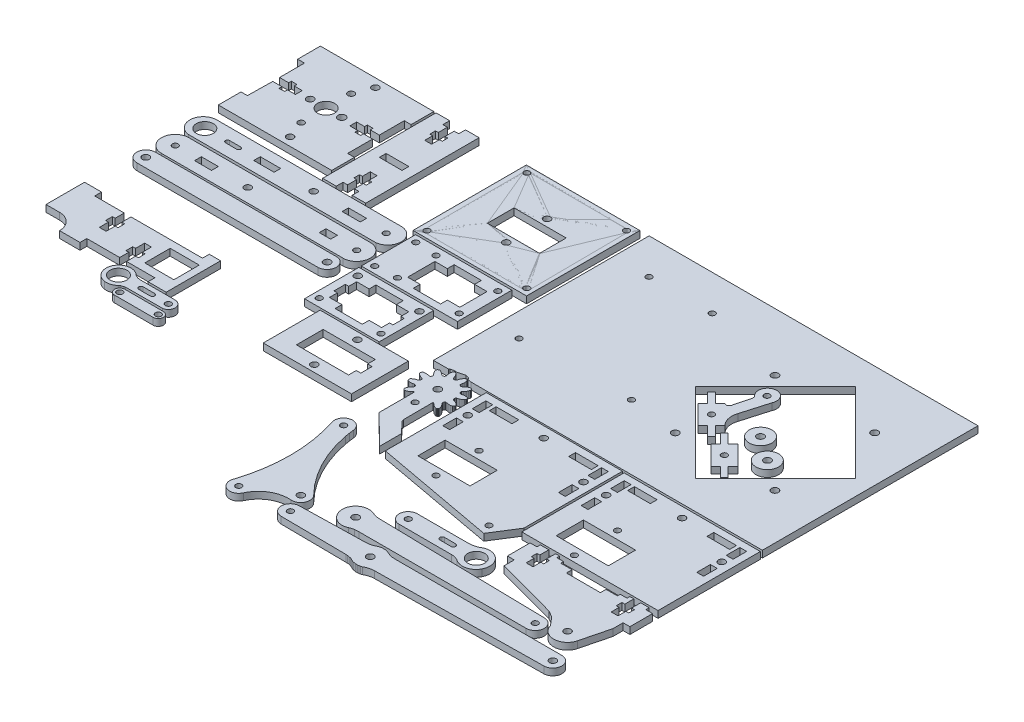
from build123d import *

# Parameters (mm, degrees)
SKETCH3_R              = 3.75
SKETCH3_R_2            = 1.53326
SKETCH3_R_3            = 1.42391285
SKETCH3_R_4            = 1.648176726
SKETCH3_R_5            = 1.5
SKETCH3_R_6            = 1.352434515
SKETCH3_R_7            = 1.489057141
BOSS_EXTRUDE1_DEPTH    = 3
SKETCH5_W              = 10
SKETCH5_H              = 3
BOSS_EXTRUDE2_DEPTH    = 3
SKETCH8_R              = 1.5
SKETCH8_R_2            = 1.500007616
SKETCH8_R_3            = 1.299978659
SKETCH8_R_4            = 1.299998754
SKETCH8_R_5            = 1.294984531
SKETCH8_R_6            = 1.2999789
SKETCH8_W              = 23
SKETCH8_H              = 11.8
BOSS_EXTRUDE3_DEPTH    = 3
SKETCH14_R             = 5.00001662
SKETCH14_R_2           = 1.550029918
BOSS_EXTRUDE5_DEPTH    = 3
SKETCH14_R_3           = 5.003976988
SKETCH14_R_4           = 1.550023427
BOSS_EXTRUDE5_2_DEPTH  = 3
SKETCH14_R_5           = 1.299993938
SKETCH14_R_6           = 1.300026864
BOSS_EXTRUDE5_3_DEPTH  = 3
SKETCH14_R_7           = 1.299969961
BOSS_EXTRUDE5_4_DEPTH  = 3
SKETCH10_W             = 145.044336183
SKETCH10_H             = 95.097461227
SKETCH10_R             = 1.549963263
SKETCH10_R_2           = 1.2999789
SKETCH10_R_3           = 1.2905
SKETCH10_R_4           = 1.55
SKETCH10_R_5           = 1.564093454
SKETCH10_R_6           = 1.556446812
BOSS_EXTRUDE4_DEPTH    = 3
SKETCH16_W             = 60.073762511
SKETCH16_H             = 45.112571339
SKETCH16_R             = 1.5
SKETCH16_R_2           = 1.2999789
SKETCH16_R_3           = 1.296234989
SKETCH16_R_4           = 1.500012067
SKETCH16_W_2           = 10
SKETCH16_H_2           = 3
SKETCH16_W_3           = 3
SKETCH16_H_3           = 6
SKETCH16_W_4           = 23
SKETCH16_H_4           = 12
BOSS_EXTRUDE6_DEPTH    = 3
SKETCH18_R             = 1.3
SKETCH18_R_2           = 3.75
BOSS_EXTRUDE7_DEPTH    = 3
SKETCH18_R_3           = 1.300013016
SKETCH18_R_4           = 1.549974532
BOSS_EXTRUDE7_2_DEPTH  = 3
SKETCH18_R_5           = 1.300006116
SKETCH18_R_6           = 1.54998491
SKETCH18_R_7           = 1.499986033
BOSS_EXTRUDE7_3_DEPTH  = 3
SKETCH18_R_8           = 1.500000462
SKETCH18_R_9           = 1.300040399
SKETCH18_R_10          = 1.299952653
BOSS_EXTRUDE7_4_DEPTH  = 3
SKETCH18_W             = 12.829032701
SKETCH18_H             = 11.189767412
BOSS_EXTRUDE7_5_DEPTH  = 3
SKETCH18_R_11          = 3.750002352
BOSS_EXTRUDE7_6_DEPTH  = 3
SKETCH18_R_12          = 1.300003796
SKETCH18_R_13          = 1.299998754
BOSS_EXTRUDE7_7_DEPTH  = 3
SKETCH18_W_2           = 42.429633814
SKETCH18_H_2           = 23.954946388
SKETCH18_R_14          = 1.298883823
SKETCH18_R_15          = 1.299997434
SKETCH18_R_16          = 1.298943094
SKETCH18_R_17          = 1.299995677
SKETCH18_R_18          = 1.2989
SKETCH18_R_19          = 1.30391221
BOSS_EXTRUDE7_8_DEPTH  = 3
SKETCH18_W_3           = 32.923456075
SKETCH18_H_3           = 23.983775616
SKETCH18_R_20          = 1.501568812
SKETCH18_R_21          = 1.29891
SKETCH18_R_22          = 1.30127611
SKETCH18_R_23          = 1.500007616
BOSS_EXTRUDE7_9_DEPTH  = 3
SKETCH18_R_24          = 3.750099942
SKETCH18_R_25          = 1.5
SKETCH18_W_4           = 8
SKETCH18_H_4           = 2.8
SKETCH18_W_5           = 9
SKETCH18_H_5           = 2.9
BOSS_EXTRUDE7_10_DEPTH = 3
SKETCH18_R_26          = 1.299997387
SKETCH18_W_6           = 7.5
SKETCH18_H_6           = 3
SKETCH18_W_7           = 5
BOSS_EXTRUDE7_11_DEPTH = 3
SKETCH18_R_27          = 1.550000311
SKETCH18_R_28          = 1.550002261
BOSS_EXTRUDE7_12_DEPTH = 3
SKETCH18_W_8           = 38.915686477
SKETCH18_H_7           = 25.075379571
BOSS_EXTRUDE7_13_DEPTH = 3
SKETCH17_R             = 1.5
BOSS_EXTRUDE8_DEPTH    = 3
SKETCH23_R             = 1.502981158
SKETCH23_R_2           = 1.299837753
SKETCH23_R_3           = 1.299813959
SKETCH23_R_4           = 1.311183002
SKETCH23_R_5           = 1.5
SKETCH23_W             = 10
SKETCH23_H             = 3
SKETCH23_W_2           = 3
SKETCH23_H_2           = 6
SKETCH23_W_3           = 23
SKETCH23_H_3           = 12
BOSS_EXTRUDE9_DEPTH    = 3
SKETCH27_R             = 10.542052595
BOSS_EXTRUDE13_DEPTH   = 3
CUT_EXTRUDE5_START     = -1
CUT_EXTRUDE5_DEPTH     = 348.749880665
CIRPATTERN1_COUNT      = 12
SKETCH28_R             = 1.299992662
BOSS_EXTRUDE14_DEPTH   = 3
SKETCH29_R             = 1.550037861
CUT_EXTRUDE6_DEPTH     = 3
SKETCH30_W             = 50.052698669
SKETCH30_H             = 49.917064019
SKETCH30_R             = 1.295977319
SKETCH30_R_2           = 1.498315826
SKETCH30_R_3           = 1.299978659
SKETCH30_R_4           = 1.493585645
SKETCH30_R_5           = 1.298054303
SKETCH30_R_6           = 1.295949613
SKETCH30_W_2           = 23.14749428
SKETCH30_H_2           = 11.799314187
BOSS_EXTRUDE15_DEPTH   = 3


with BuildPart() as part:
    # Sketch3 → Boss-Extrude1 (new body)
    with BuildSketch(Plane(origin=(0, 0, 0), x_dir=(1, 0, 0), z_dir=(0, 1, 0))):
        Polygon((0, 0), (50, 0), (50, -10), (47, -10), (47, -21), (43, -21), (43, -19.82589), (40.5, -19.75), (40.5, -21), (37, -21), (37, -24), (40.5, -24), (40.5, -25.274955495), (43, -25.25), (43, -24), (47, -24), (47, -35), (50, -35), (50, -45), (0, -45), (0, -35), (2.827127063, -35), (3, -24), (7, -24), (7, -25.274955495), (9.5, -25.17411), (9.5, -24), (13, -24), (13, -21), (9.5, -21), (9.5, -19.82589), (7, -19.82589), (7, -21), (3, -21), (3, -10), (0, -10), align=None)
        with Locations((25, -22.499992494)):
            Circle(SKETCH3_R, mode=Mode.SUBTRACT)
        with Locations((18, -22.5)):
            Circle(SKETCH3_R_2, mode=Mode.SUBTRACT)
        with Locations((24.990375, -11.417625)):
            Circle(SKETCH3_R_3, mode=Mode.SUBTRACT)
        with Locations((31.950646971, -22.511932172)):
            Circle(SKETCH3_R_4, mode=Mode.SUBTRACT)
        with Locations((28, -3.75)):
            Circle(SKETCH3_R_5, mode=Mode.SUBTRACT)
        with Locations((25, -33.494077682)):
            Circle(SKETCH3_R_6, mode=Mode.SUBTRACT)
        with Locations((27.986369291, -41.339428739)):
            Circle(SKETCH3_R_7, mode=Mode.SUBTRACT)
    extrude(amount=BOSS_EXTRUDE1_DEPTH)


with BuildPart() as body_2:
    # Sketch5 → Boss-Extrude2 (new body)
    with BuildSketch(Plane(origin=(0, 0, 0), x_dir=(1, 0, 0), z_dir=(0, 1, 0))):
        Polygon((57, 0), (57, -3), (59, -3), (59, -7), (57.75, -7), (57.75, -9.5), (59, -9.5), (59, -13), (62, -13), (62, -9.5), (63.25, -9.5), (63.25, -7), (62, -7), (62, -3), (64, -3), (64, 0), (70, 0), (70, -50), (64, -50), (64, -47), (62, -47), (62, -43), (63.25, -43), (63.25, -40.5), (62, -40.5), (62, -37), (59, -37), (59, -40.5), (57.75, -40.5), (57.75, -43), (59, -43), (59, -47), (57, -47), (57, -50), (51, -50), (51, 0), align=None)
        with Locations((60.5, -28)):
            Rectangle(SKETCH5_W, SKETCH5_H, mode=Mode.SUBTRACT)
    extrude(amount=BOSS_EXTRUDE2_DEPTH)


with BuildPart() as body_3:
    # Sketch8 → Boss-Extrude3 (new body)
    with BuildSketch(Plane(origin=(0, 0, 0), x_dir=(1, 0, 0), z_dir=(0, 1, 0))):
        Polygon((90.835790983, -0.1468305), (90.835790983, -49.979936215), (140.829753359, -49.979936215), (140.829753359, 0), align=None)
        with Locations((116, -16.000034227)):
            Circle(SKETCH8_R, mode=Mode.SUBTRACT)
        with Locations((116, -34)):
            Circle(SKETCH8_R_2, mode=Mode.SUBTRACT)
        with Locations((138, -3)):
            Circle(SKETCH8_R_3, mode=Mode.SUBTRACT)
        with Locations((94, -47)):
            Circle(SKETCH8_R_4, mode=Mode.SUBTRACT)
        with Locations((93.972384297, -2.870240899)):
            Circle(SKETCH8_R_5, mode=Mode.SUBTRACT)
        with Locations((138, -47)):
            Circle(SKETCH8_R_6, mode=Mode.SUBTRACT)
        with Locations((116, -25)):
            Rectangle(SKETCH8_W, SKETCH8_H, mode=Mode.SUBTRACT)
    extrude(amount=BOSS_EXTRUDE3_DEPTH)


with BuildPart() as body_4:
    # Sketch14 → Boss-Extrude5 (new body)
    with BuildSketch(Plane(origin=(0, 0, 0), x_dir=(1, 0, 0), z_dir=(0, 1, 0))):
        with Locations((246.15535, -52.035605)):
            Circle(SKETCH14_R)
        with Locations((246.15535, -52.035605)):
            Circle(SKETCH14_R_2, mode=Mode.SUBTRACT)
    extrude(amount=BOSS_EXTRUDE5_DEPTH)


with BuildPart() as body_5:
    # Sketch14 → Boss-Extrude5 2 (new body)
    with BuildSketch(Plane(origin=(0, 0, 0), x_dir=(1, 0, 0), z_dir=(0, 1, 0))):
        with Locations((256.781771683, -59.687732945)):
            Circle(SKETCH14_R_3)
        with Locations((256.82285, -59.64665)):
            Circle(SKETCH14_R_4, mode=Mode.SUBTRACT)
    extrude(amount=BOSS_EXTRUDE5_2_DEPTH)


with BuildPart() as body_6:
    # Sketch14 → Boss-Extrude5 3 (new body)
    with BuildSketch(Plane(origin=(0, 0, 0), x_dir=(1, 0, 0), z_dir=(0, 1, 0))):
        with BuildLine():
            Line((234.1407, -55.70278), (232.0194, -57.8241))
            Line((232.0194, -57.8241), (236.262, -62.06674))
            Line((236.262, -62.06674), (234.565, -63.7638))
            Line((234.565, -63.7638), (230.3223, -59.52115))
            Line((230.3223, -59.52115), (228.201, -61.64247))
            Line((228.201, -61.64247), (219.7157, -53.15719))
            Line((219.7157, -53.15719), (221.837, -51.03587))
            Line((221.837, -51.03587), (217.5944, -46.79323))
            Line((217.5944, -46.79323), (219.2915, -45.09618))
            Line((219.2915, -45.09618), (223.5341, -49.33882))
            Line((223.5341, -49.33882), (225.6554, -47.2175))
            ThreePointArc((225.6554, -47.2175), (227.096966061, -47.504240019), (227.913545624, -46.282139221))
            Line((227.913545624, -46.282139221), (229.7551, -39.43538))
            Line((229.7551, -39.43538), (229.7551, -38.198592891))
            ThreePointArc((229.7551, -38.198592891), (231.075391639, -31.018520336), (235.828906167, -36.559342615))
            Line((235.828906167, -36.559342615), (232.44365, -48.27816))
            ThreePointArc((232.44365, -48.27816), (232.223292436, -52.234785151), (234.1407, -55.70278))
        make_face()
        with Locations((232.1046, -35.11147)):
            Circle(SKETCH14_R_5, mode=Mode.SUBTRACT)
        with Locations((226.9282, -54.429985)):
            Circle(SKETCH14_R_6, mode=Mode.SUBTRACT)
    extrude(amount=BOSS_EXTRUDE5_3_DEPTH)


with BuildPart() as body_7:
    # Sketch14 → Boss-Extrude5 4 (new body)
    with BuildSketch(Plane(origin=(0, 0, 0), x_dir=(1, 0, 0), z_dir=(0, 1, 0))):
        Polygon((244.0402, -59.94542), (252.5255, -68.4307), (250.4042, -70.55202), (254.6468, -74.79466), (252.9497, -76.49172), (248.7071, -72.24908), (246.5858, -74.3704), (238.1005, -65.88512), (240.2218, -63.7638), (235.9792, -59.52115), (237.6762, -57.8241), (241.9189, -62.06674), align=None)
        with Locations((245.313, -67.157905)):
            Circle(SKETCH14_R_7, mode=Mode.SUBTRACT)
    extrude(amount=BOSS_EXTRUDE5_4_DEPTH)


with BuildPart() as body_8:
    # Sketch10 → Boss-Extrude4 (new body)
    with BuildSketch(Plane(origin=(0, 0, 0), x_dir=(1, 0, 0), z_dir=(0, 1, 0))):
        with Locations((217.493156088, -47.548730614)):
            Rectangle(SKETCH10_W, SKETCH10_H)
        with Locations((226, -25.5)):
            Circle(SKETCH10_R, mode=Mode.SUBTRACT)
        with Locations((188.5, -15.7)):
            Circle(SKETCH10_R_2, mode=Mode.SUBTRACT)
        with Locations((160.6, -15.7)):
            Circle(SKETCH10_R_2, mode=Mode.SUBTRACT)
        with Locations((155.5, -67.875)):
            Circle(SKETCH10_R_3, mode=Mode.SUBTRACT)
        with Locations((203.7, -66.5)):
            Circle(SKETCH10_R_2, mode=Mode.SUBTRACT)
        with Locations((226, -69.5)):
            Circle(SKETCH10_R_4, mode=Mode.SUBTRACT)
        with Locations((269.939993732, -25.491820621)):
            Circle(SKETCH10_R_5, mode=Mode.SUBTRACT)
        with Locations((269.922899471, -69.483321735)):
            Circle(SKETCH10_R_6, mode=Mode.SUBTRACT)
        Polygon((247.98872777, -12.095839846), (283.198240379, -47.305352454), (247.98872777, -82.514865063), (212.779215162, -47.305352454), align=None, mode=Mode.SUBTRACT)
    extrude(amount=BOSS_EXTRUDE4_DEPTH)

    # Sketch27 → Boss-Extrude13 (add)
    with BuildSketch(Plane(origin=(0, 0, 0), x_dir=(1, 0, 0), z_dir=(0, 1, 0))):
        with Locations((156.933289023, -105.157126991)):
            Circle(SKETCH27_R)
    extrude(amount=BOSS_EXTRUDE13_DEPTH)

    # Sketch24 → Cut-Extrude5 (cut)
    with BuildSketch(Plane(origin=(0, 0, 0), x_dir=(1, 0, 0), z_dir=(0, 1, 0)).offset(CUT_EXTRUDE5_START)):
        Polygon((146.295463365, -102.258026196), (146.734120528, -102.514029645), (146.734120528, -102.846697253), (146.8825, -103.1532), (147.0178, -103.3192), (147.4553, -103.675), (147.9381, -103.9665), (148.4567, -104.1881), (149.001, -104.3353), (149.2258, -104.4129), (149.421, -104.5485), (149.572, -104.7322), (149.6674, -104.9499), (149.6674, -105.086518838), (149.6674, -105.35931762), (149.6674, -105.57468508), (149.421, -105.8223), (149.1134, -105.957095774), (148.843969569, -106.075164966), (148.4567, -106.1828), (147.9381, -106.4044), (147.4553, -106.723311534), (147.0178, -107.0517), (146.8825, -107.2176), (146.7646, -107.6252), (146.7905, -107.8378), (146.387479964, -107.886897925), (145.400373324, -104.3353), (145.873599656, -102.6992775), align=None)
    cut_extrude5 = extrude(amount=CUT_EXTRUDE5_DEPTH, mode=Mode.SUBTRACT)

    # CirPattern1: Cut-Extrude5 ×12 about axis
    cirpattern1_axis = Axis((156.933289023, 3, 105.157126991), (0, -1, 0))
    for i in range(1, CIRPATTERN1_COUNT):
        add(cut_extrude5.rotate(cirpattern1_axis, i * 360 / CIRPATTERN1_COUNT), mode=Mode.SUBTRACT)

    # Sketch28 → Boss-Extrude14 (add)
    with BuildSketch(Plane(origin=(0, 0, 0), x_dir=(1, 0, 0), z_dir=(0, 1, 0))):
        Polygon((165.897383159, -139.82250261), (165.897383159, -130.125905708), (161.277, -125.2548), (160.9869, -124.3621), (160.927849447, -111.240792422), (152.884646942, -111.319726794), (152.884646942, -126.99508265), align=None)
        with Locations((156.95, -115.18545)):
            Circle(SKETCH28_R, mode=Mode.SUBTRACT)
    extrude(amount=BOSS_EXTRUDE14_DEPTH)

    # Sketch29 → Cut-Extrude6 (cut)
    with BuildSketch(Plane(origin=(0, 0, 0), x_dir=(1, 0, 0), z_dir=(0, 1, 0))):
        with Locations((156.95, -105.1854)):
            Circle(SKETCH29_R)
    extrude(amount=CUT_EXTRUDE6_DEPTH, mode=Mode.SUBTRACT)


with BuildPart() as body_9:
    # Sketch16 → Boss-Extrude6 (new body)
    with BuildSketch(Plane(origin=(0, 0, 0), x_dir=(1, 0, 0), z_dir=(0, 1, 0))):
        with Locations((260.007317348, -118.580980031)):
            Rectangle(SKETCH16_W, SKETCH16_H)
        with Locations((260, -100.5)):
            Circle(SKETCH16_R, mode=Mode.SUBTRACT)
        with Locations((250.5, -119.5)):
            Circle(SKETCH16_R_2, mode=Mode.SUBTRACT)
        with Locations((250.5, -138.465098587)):
            Circle(SKETCH16_R_3, mode=Mode.SUBTRACT)
        with Locations((285.5, -108.5)):
            Circle(SKETCH16_R, mode=Mode.SUBTRACT)
        with Locations((234.5, -108.5)):
            Circle(SKETCH16_R_4, mode=Mode.SUBTRACT)
        with Locations((242.5, -100.5)):
            Rectangle(SKETCH16_W_2, SKETCH16_H_2, mode=Mode.SUBTRACT)
        with Locations((277.5, -100.5)):
            Rectangle(SKETCH16_W_2, SKETCH16_H_2, mode=Mode.SUBTRACT)
        with Locations((285.5, -102)):
            Rectangle(SKETCH16_W_3, SKETCH16_H_3, mode=Mode.SUBTRACT)
        with Locations((285.5, -115)):
            Rectangle(SKETCH16_W_3, SKETCH16_H_3, mode=Mode.SUBTRACT)
        with Locations((250.5, -129)):
            Rectangle(SKETCH16_W_4, SKETCH16_H_4, mode=Mode.SUBTRACT)
        with Locations((234.5, -115)):
            Rectangle(SKETCH16_W_3, SKETCH16_H_3, mode=Mode.SUBTRACT)
        with Locations((234.5, -102)):
            Rectangle(SKETCH16_W_3, SKETCH16_H_3, mode=Mode.SUBTRACT)
    extrude(amount=BOSS_EXTRUDE6_DEPTH)


with BuildPart() as body_10:
    # Sketch18 → Boss-Extrude7 (new body)
    with BuildSketch(Plane(origin=(0, 0, 0), x_dir=(1, 0, 0), z_dir=(0, 1, 0))):
        with BuildLine():
            Line((200, -157.2561), (222.460912978, -157.2561))
            ThreePointArc((222.460912978, -157.2561), (225.201625308, -156.860687351), (227.7188, -155.7067))
            ThreePointArc((227.7188, -155.7067), (234.425465186, -157.247273828), (235.304856396, -164.072183844))
            ThreePointArc((235.304856396, -164.072183844), (231.29829974, -167.169454237), (226.342, -166.1299))
            ThreePointArc((226.342, -166.1299), (224.771562074, -165.505823803), (223.0953, -165.2916))
            Line((223.0953, -165.2916), (200, -165.2561))
            ThreePointArc((200, -165.2561), (196, -161.2561), (200, -157.2561))
        make_face()
        with Locations((200, -161.2561)):
            Circle(SKETCH18_R, mode=Mode.SUBTRACT)
        with Locations((230, -161.2561)):
            Circle(SKETCH18_R_2, mode=Mode.SUBTRACT)
        with BuildLine():
            Line((215.010554012, -160.267363361), (219.919025801, -160.267363361))
            ThreePointArc((219.919025801, -160.267363361), (220.932172771, -161.280510331), (219.919025801, -162.293657301))
            Line((219.919025801, -162.293657301), (215.010554012, -162.293657301))
            ThreePointArc((215.010554012, -162.293657301), (213.997407042, -161.280510331), (215.010554012, -160.267363361))
        make_face(mode=Mode.SUBTRACT)
    extrude(amount=BOSS_EXTRUDE7_DEPTH)


with BuildPart() as body_11:
    # Sketch18 → Boss-Extrude7 2 (new body)
    with BuildSketch(Plane(origin=(0, 0, 0), x_dir=(1, 0, 0), z_dir=(0, 1, 0))):
        with BuildLine():
            Line((267.8316, -169.0008), (193.5528, -167.5414))
            ThreePointArc((193.5528, -167.5414), (192.887635317, -167.455400386), (192.219, -167.4028))
            ThreePointArc((192.219, -167.4028), (191.55333704, -167.293716328), (190.927, -167.0433))
            ThreePointArc((190.927, -167.0433), (189.004137555, -166.359961344), (186.9656, -166.2666))
            ThreePointArc((186.9656, -166.2666), (183.057707097, -168.375067718), (181.785321347, -172.629277111))
            ThreePointArc((181.785321347, -172.629277111), (182.766023818, -175.434472878), (184.9077, -177.4946))
            ThreePointArc((184.9077, -177.4946), (187.529228779, -178.261740952), (190.201, -177.6938))
            ThreePointArc((190.201, -177.6938), (191.138575639, -177.324647201), (192.1236, -177.1124))
            ThreePointArc((192.1236, -177.1124), (193.072931136, -177.018971757), (194.026338605, -176.987784562))
            Line((194.026338605, -176.987784562), (267.753, -177))
            ThreePointArc((267.753, -177), (271.752817879, -173.03931598), (267.8316, -169.0008))
        make_face()
        with Locations((267.75305, -173)):
            Circle(SKETCH18_R_3, mode=Mode.SUBTRACT)
        with Locations((187.7569, -172.2142)):
            Circle(SKETCH18_R_4, mode=Mode.SUBTRACT)
    extrude(amount=BOSS_EXTRUDE7_2_DEPTH)


with BuildPart() as body_12:
    # Sketch18 → Boss-Extrude7 3 (new body)
    with BuildSketch(Plane(origin=(0, 0, 0), x_dir=(1, 0, 0), z_dir=(0, 1, 0))):
        with BuildLine():
            Line((170.9118, -180.2312), (199.7222, -179.5779))
            ThreePointArc((199.7222, -179.5779), (201.8376067, -179.258428395), (203.8045, -178.4168))
            ThreePointArc((203.8045, -178.4168), (204.091909858, -178.286013473), (204.4002, -178.2177))
            ThreePointArc((204.4002, -178.2177), (204.710444247, -178.165809141), (205.0136, -178.0819))
            ThreePointArc((205.0136, -178.0819), (205.321933314, -178.013737517), (205.6377, -178.0111))
            ThreePointArc((205.6377, -178.0111), (205.951938844, -178.024906904), (206.2659, -178.0058))
            ThreePointArc((206.2659, -178.0058), (206.581681815, -178.003169495), (206.8911, -178.0663))
            ThreePointArc((206.8911, -178.0663), (207.195554991, -178.145209985), (207.5066, -178.1918))
            ThreePointArc((207.5066, -178.1918), (207.816056495, -178.254878116), (208.1056, -178.381))
            ThreePointArc((208.1056, -178.381), (208.387003464, -178.521505982), (208.6816, -178.6317))
            ThreePointArc((208.6816, -178.6317), (209.028512895, -178.762712354), (209.3587, -178.9315))
            ThreePointArc((209.3587, -178.9315), (209.697618418, -179.085368069), (210.0607, -179.1673))
            ThreePointArc((210.0607, -179.1673), (210.425847774, -179.23210759), (210.7815, -179.3372))
            ThreePointArc((210.7815, -179.3372), (211.142946952, -179.426036198), (211.5149, -179.4397))
            ThreePointArc((211.5149, -179.4397), (211.885759287, -179.436159612), (212.2547, -179.474))
            Line((212.2547, -179.474), (286, -179.474))
            ThreePointArc((286, -179.474), (289.999936464, -183.44772236), (286.0526, -187.4737))
            Line((286.0526, -187.4737), (212.3137, -188.4434))
            ThreePointArc((212.3137, -188.4434), (210.172193977, -188.749428152), (208.1793, -189.5909))
            ThreePointArc((208.1793, -189.5909), (207.891445225, -189.720719249), (207.5829, -189.7879))
            ThreePointArc((207.5829, -189.7879), (207.272504044, -189.838638491), (206.9691, -189.9215))
            ThreePointArc((206.9691, -189.9215), (206.660508026, -189.988642594), (206.3447, -189.9902))
            ThreePointArc((206.3447, -189.9902), (206.030521556, -189.975273726), (205.7165, -189.9932))
            ThreePointArc((205.7165, -189.9932), (205.400707852, -189.994666467), (205.0915, -189.9305))
            ThreePointArc((205.0915, -189.9305), (204.787292957, -189.850585166), (204.4764, -189.8029))
            ThreePointArc((204.4764, -189.8029), (204.167188014, -189.738719346), (203.8781, -189.6116))
            ThreePointArc((203.8781, -189.6116), (203.597188037, -189.470098991), (203.303, -189.3588))
            ThreePointArc((203.303, -189.3588), (202.961060971, -189.228132955), (202.6358, -189.0602))
            ThreePointArc((202.6358, -189.0602), (202.302040587, -188.90677466), (201.9442, -188.8238))
            ThreePointArc((201.9442, -188.8238), (201.584178805, -188.757466456), (201.2338, -188.6514))
            ThreePointArc((201.2338, -188.6514), (200.877693771, -188.56114241), (200.5107, -188.5446))
            ThreePointArc((200.5107, -188.5446), (200.14467333, -188.544853065), (199.7809, -188.5043))
            Line((199.7809, -188.5043), (170.9644, -188.2299))
            ThreePointArc((170.9644, -188.2299), (167.002618868, -184.256429994), (170.9118, -180.2312))
        make_face()
        with Locations((171.00245, -184.2301)):
            Circle(SKETCH18_R_5, mode=Mode.SUBTRACT)
        with Locations((206.00175, -184)):
            Circle(SKETCH18_R_6, mode=Mode.SUBTRACT)
        with Locations((286, -183.474)):
            Circle(SKETCH18_R_7, mode=Mode.SUBTRACT)
    extrude(amount=BOSS_EXTRUDE7_3_DEPTH)


with BuildPart() as body_13:
    # Sketch18 → Boss-Extrude7 4 (new body)
    with BuildSketch(Plane(origin=(0, 0, 0), x_dir=(1, 0, 0), z_dir=(0, 1, 0))):
        with BuildLine():
            Line((154.2411, -141.4201), (154.5835, -143.5068))
            ThreePointArc((154.5835, -143.5068), (160.144624366, -159.404783515), (170.0608, -173.0188))
            ThreePointArc((170.0608, -173.0188), (170.830688309, -177.531456134), (166.8709, -179.8286))
            ThreePointArc((166.8709, -179.8286), (159.030856109, -181.627977059), (153.6593, -187.6155))
            ThreePointArc((153.6593, -187.6155), (148.567775867, -189.700195924), (146.2067, -184.7308))
            ThreePointArc((146.2067, -184.7308), (149.661659143, -162.874197015), (146.170332469, -141.023373809))
            ThreePointArc((146.170332469, -141.023373809), (149.132248913, -135.851413376), (153.9775, -139.3221))
            Line((153.9775, -139.3221), (154.2411, -141.4201))
        make_face()
        with Locations((167.22995, -175.84475)):
            Circle(SKETCH18_R_8, mode=Mode.SUBTRACT)
        with Locations((150, -186)):
            Circle(SKETCH18_R_9, mode=Mode.SUBTRACT)
        with Locations((150, -139.7458)):
            Circle(SKETCH18_R_10, mode=Mode.SUBTRACT)
    extrude(amount=BOSS_EXTRUDE7_4_DEPTH)


with BuildPart() as body_14:
    # Sketch18 → Boss-Extrude7 5 (new body)
    with BuildSketch(Plane(origin=(0, 0, 0), x_dir=(1, 0, 0), z_dir=(0, 1, 0))):
        with BuildLine():
            Line((20.5, -107), (7.5, -107))
            Line((7.5, -107), (7.5, -104))
            Line((7.5, -104), (0, -104))
            Line((0, -104), (0, -121))
            Line((0, -121), (6, -121))
            ThreePointArc((6, -121), (10.949747468, -123.050252532), (13, -128))
            Line((13, -128), (22, -128))
            Line((22, -128), (22, -125))
            Line((22, -125), (36.5, -125))
            Line((36.5, -125), (36.5, -121))
            Line((36.5, -121), (35.25, -121))
            Line((35.25, -121), (35.25, -118))
            Line((35.25, -118), (36.5, -118))
            Line((36.5, -118), (36.5, -114))
            Line((36.5, -114), (39.5, -114))
            Line((39.5, -114), (39.5, -118))
            Line((39.5, -118), (40.75, -118))
            Line((40.75, -118), (40.75, -121))
            Line((40.75, -121), (39.5, -121))
            Line((39.5, -121), (39.5, -125))
            Line((39.5, -125), (52, -125))
            Line((52, -125), (52, -128))
            Line((52, -128), (60, -128))
            Line((60, -128), (60, -104))
            Line((60, -104), (55, -104))
            Line((55, -104), (55, -107))
            Line((55, -107), (23.5, -107))
            Line((23.5, -107), (23.5, -111))
            Line((23.5, -111), (24.75, -111))
            Line((24.75, -111), (24.75, -114))
            Line((24.75, -114), (23.5, -114))
            Line((23.5, -114), (23.5, -118))
            Line((23.5, -118), (20.5, -118))
            Line((20.5, -118), (20.5, -114))
            Line((20.5, -114), (19.25, -114))
            Line((19.25, -114), (19.25, -111))
            Line((19.25, -111), (20.5, -111))
            Line((20.5, -111), (20.5, -107))
        make_face()
        with Locations((50.526628558, -115.951763078)):
            Rectangle(SKETCH18_W, SKETCH18_H, mode=Mode.SUBTRACT)
    extrude(amount=BOSS_EXTRUDE7_5_DEPTH)


with BuildPart() as body_15:
    # Sketch18 → Boss-Extrude7 6 (new body)
    with BuildSketch(Plane(origin=(0, 0, 0), x_dir=(1, 0, 0), z_dir=(0, 1, 0))):
        with BuildLine():
            Line((64.95448, -129), (49.75522, -129))
            ThreePointArc((49.75522, -129), (47.712701098, -128.587313557), (45.99063, -127.414))
            ThreePointArc((45.99063, -127.414), (37.87780457, -130.093403704), (42.22112, -137.4509))
            ThreePointArc((42.22112, -137.4509), (44.797074902, -137.216380757), (46.98538, -135.8373))
            ThreePointArc((46.98538, -135.8373), (47.218685761, -135.655018367), (47.49213, -135.5415))
            ThreePointArc((47.49213, -135.5415), (48.051403531, -135.365158762), (48.59174, -135.1373))
            Line((48.59174, -135.1373), (49.16944, -135.0344))
            Line((49.16944, -135.0344), (65.42379, -134.9631))
            ThreePointArc((65.42379, -134.9631), (67.945249696, -131.764637289), (64.95448, -129))
        make_face()
        with Locations((42.95448, -132)):
            Circle(SKETCH18_R_11, mode=Mode.SUBTRACT)
        with Locations((64.95448, -132)):
            Circle(SKETCH18_R, mode=Mode.SUBTRACT)
        with BuildLine():
            Line((52.879559015, -131.026796451), (57.938701055, -131.026796451))
            ThreePointArc((57.938701055, -131.026796451), (58.911922505, -132.000017901), (57.938701055, -132.97323935))
            Line((57.938701055, -132.97323935), (52.879559015, -132.97323935))
            ThreePointArc((52.879559015, -132.97323935), (51.906337565, -132.000017901), (52.879559015, -131.026796451))
        make_face(mode=Mode.SUBTRACT)
    extrude(amount=BOSS_EXTRUDE7_6_DEPTH)


with BuildPart() as body_16:
    # Sketch18 → Boss-Extrude7 7 (new body)
    with BuildSketch(Plane(origin=(0, 0, 0), x_dir=(1, 0, 0), z_dir=(0, 1, 0))):
        with BuildLine():
            Line((49.75522, -136), (66.75522, -136))
            ThreePointArc((66.75522, -136), (69.00522, -138.25), (66.75522, -140.5))
            Line((66.75522, -140.5), (49.75522, -140.5))
            ThreePointArc((49.75522, -140.5), (47.50522, -138.25), (49.75522, -136))
        make_face()
        with Locations((49.75522, -138.25)):
            Circle(SKETCH18_R_12, mode=Mode.SUBTRACT)
        with Locations((66.75522, -138.25)):
            Circle(SKETCH18_R_13, mode=Mode.SUBTRACT)
    extrude(amount=BOSS_EXTRUDE7_7_DEPTH)


with BuildPart() as body_17:
    # Sketch18 → Boss-Extrude7 8 (new body)
    with BuildSketch(Plane(origin=(0, 0, 0), x_dir=(1, 0, 0), z_dir=(0, 1, 0))):
        with Locations((114.225592474, -62.995130295)):
            Rectangle(SKETCH18_W_2, SKETCH18_H_2)
        with Locations((105.5, -71.5)):
            Circle(SKETCH18_R_14, mode=Mode.SUBTRACT)
        with Locations((96, -72.05)):
            Circle(SKETCH18_R_15, mode=Mode.SUBTRACT)
        with Locations((105.5, -54.5)):
            Circle(SKETCH18_R_16, mode=Mode.SUBTRACT)
        with Locations((96, -53.95)):
            Circle(SKETCH18_R_17, mode=Mode.SUBTRACT)
        with Locations((132.7, -71.5)):
            Circle(SKETCH18_R_18, mode=Mode.SUBTRACT)
        with Locations((132.704492308, -54.463182304)):
            Circle(SKETCH18_R_19, mode=Mode.SUBTRACT)
        Polygon((113, -54), (125, -54), (125, -57), (130.5, -57), (130.5, -69), (125, -69), (125, -72), (113, -72), (113, -69), (107.5, -69), (107.5, -57), (113, -57), align=None, mode=Mode.SUBTRACT)
    extrude(amount=BOSS_EXTRUDE7_8_DEPTH)


with BuildPart() as body_18:
    # Sketch18 → Boss-Extrude7 9 (new body)
    with BuildSketch(Plane(origin=(0, 0, 0), x_dir=(1, 0, 0), z_dir=(0, 1, 0))):
        with Locations((109.472503605, -88.008698539)):
            Rectangle(SKETCH18_W_3, SKETCH18_H_3)
        with Locations((95.995543612, -79.512733943)):
            Circle(SKETCH18_R_20, mode=Mode.SUBTRACT)
        with Locations((96, -96.5)):
            Circle(SKETCH18_R_21, mode=Mode.SUBTRACT)
        with Locations((123.206540144, -96.482670767)):
            Circle(SKETCH18_R_22, mode=Mode.SUBTRACT)
        with Locations((123.2, -79.5)):
            Circle(SKETCH18_R_23, mode=Mode.SUBTRACT)
        Polygon((103.5, -79), (115.5, -79), (115.5, -82), (121, -82), (121, -85.5), (122.5, -85.5), (122.5, -90.5), (121, -90.5), (121, -94), (115.5, -94), (115.5, -97), (103.5, -97), (103.5, -94), (98, -94), (98, -90.5), (96.5, -90.5), (96.5, -85.5), (98, -85.5), (98, -82), (103.5, -82), align=None, mode=Mode.SUBTRACT)
    extrude(amount=BOSS_EXTRUDE7_9_DEPTH)


with BuildPart() as body_19:
    # Sketch18 → Boss-Extrude7 10 (new body)
    with BuildSketch(Plane(origin=(0, 0, 0), x_dir=(1, 0, 0), z_dir=(0, 1, 0))):
        with BuildLine():
            Line((5.328213, -51.03773), (86.67179, -51.03773))
            ThreePointArc((86.67179, -51.03773), (92.587015781, -56.630083622), (87.33513, -62.84957))
            Line((87.33513, -62.84957), (4.664874, -62.84957))
            ThreePointArc((4.664874, -62.84957), (-0.587012753, -56.630084068), (5.328213, -51.03773))
        make_face()
        with Locations((6.007668696, -56.973882888)):
            Circle(SKETCH18_R_24, mode=Mode.SUBTRACT)
        with Locations((86, -57)):
            Circle(SKETCH18_R, mode=Mode.SUBTRACT)
        with Locations((54, -57)):
            Circle(SKETCH18_R_25, mode=Mode.SUBTRACT)
        with Locations((72, -57)):
            Rectangle(SKETCH18_W_4, SKETCH18_H_4, mode=Mode.SUBTRACT)
        with Locations((33.5, -56.95)):
            Rectangle(SKETCH18_W_5, SKETCH18_H_5, mode=Mode.SUBTRACT)
        with BuildLine():
            Line((16, -56.088578854), (20.972747325, -56.088578854))
            ThreePointArc((20.972747325, -56.088578854), (21.858051359, -56.973882888), (20.972747325, -57.859186922))
            Line((20.972747325, -57.859186922), (16, -57.859186922))
            ThreePointArc((16, -57.859186922), (15.114695966, -56.973882888), (16, -56.088578854))
        make_face(mode=Mode.SUBTRACT)
    extrude(amount=BOSS_EXTRUDE7_10_DEPTH)


with BuildPart() as body_20:
    # Sketch18 → Boss-Extrude7 11 (new body)
    with BuildSketch(Plane(origin=(0, 0, 0), x_dir=(1, 0, 0), z_dir=(0, 1, 0))):
        with BuildLine():
            Line((86, -64), (6, -64))
            ThreePointArc((6, -64), (-0.053754882, -69.963055849), (5.909300967, -76.016810731))
            Line((5.909300967, -76.016810731), (86, -76))
            Line((86, -76), (86, -76.016810731))
            ThreePointArc((86, -76.016810731), (92.008405366, -70.008405366), (86, -64))
        make_face()
        with Locations((86, -70)):
            Circle(SKETCH18_R_26, mode=Mode.SUBTRACT)
        with Locations((38, -70)):
            Circle(SKETCH18_R_25, mode=Mode.SUBTRACT)
        with Locations((6, -70)):
            Circle(SKETCH18_R, mode=Mode.SUBTRACT)
        with Locations((19.75, -70)):
            Rectangle(SKETCH18_W_6, SKETCH18_H_6, mode=Mode.SUBTRACT)
        with Locations((73.5, -70)):
            Rectangle(SKETCH18_W_7, SKETCH18_H_6, mode=Mode.SUBTRACT)
    extrude(amount=BOSS_EXTRUDE7_11_DEPTH)


with BuildPart() as body_21:
    # Sketch18 → Boss-Extrude7 12 (new body)
    with BuildSketch(Plane(origin=(0, 0, 0), x_dir=(1, 0, 0), z_dir=(0, 1, 0))):
        with BuildLine():
            Line((4.1132945, -76.880456687), (83.901791656, -76.880456687))
            ThreePointArc((83.901791656, -76.880456687), (87.987884236, -80.966549267), (83.901791656, -85.052641847))
            Line((83.901791656, -85.052641847), (4.1132945, -85.052641847))
            ThreePointArc((4.1132945, -85.052641847), (0.02720192, -80.966549267), (4.1132945, -76.880456687))
        make_face()
        with Locations((4, -81)):
            Circle(SKETCH18_R_27, mode=Mode.SUBTRACT)
        with Locations((84, -81)):
            Circle(SKETCH18_R_28, mode=Mode.SUBTRACT)
    extrude(amount=BOSS_EXTRUDE7_12_DEPTH)


with BuildPart() as body_22:
    # Sketch18 → Boss-Extrude7 13 (new body)
    with BuildSketch(Plane(origin=(0, 0, 0), x_dir=(1, 0, 0), z_dir=(0, 1, 0))):
        with Locations((120.256950472, -113.449573571)):
            Rectangle(SKETCH18_W_8, SKETCH18_H_7)
        with Locations((120.3263, -104)):
            Circle(SKETCH18_R_25, mode=Mode.SUBTRACT)
        with Locations((120.3263, -123)):
            Circle(SKETCH18_R_25, mode=Mode.SUBTRACT)
        Polygon((108.8263, -107.6), (131.8263, -107.6), (131.8263, -111), (133.8263, -111), (133.8263, -116), (131.8263, -116), (131.8263, -119.4), (108.8263, -119.4), align=None, mode=Mode.SUBTRACT)
    extrude(amount=BOSS_EXTRUDE7_13_DEPTH)


with BuildPart() as body_23:
    # Sketch17 → Boss-Extrude8 (new body)
    with BuildSketch(Plane(origin=(0, 0, 0), x_dir=(1, 0, 0), z_dir=(0, 1, 0))):
        with BuildLine():
            Line((290, -153.5), (287, -153.5))
            Line((287, -153.5), (287, -157.958081355))
            Line((287, -157.958081355), (283.8136, -170.4839))
            ThreePointArc((283.8136, -170.4839), (278.021486737, -175.04922523), (272.1099, -170.6397))
            Line((272.1099, -170.6397), (269.0056, -167.0206))
            Line((269.0056, -167.0206), (266.265909202, -165.3796907))
            Line((266.265909202, -165.3796907), (239, -158))
            Line((239, -158), (239, -153.5))
            Line((239, -153.5), (236, -153.5))
            Line((236, -153.5), (236, -143.5))
            Line((236, -143.5), (239, -143.5))
            Line((239, -143.5), (239, -142))
            Line((239, -142), (242.75, -142))
            Line((242.75, -142), (242.75, -146))
            Line((242.75, -146), (241.5, -146))
            Line((241.5, -146), (241.5, -148.5))
            Line((241.5, -148.5), (242.75, -148.5))
            Line((242.75, -148.5), (242.75, -152))
            Line((242.75, -152), (245.75, -152))
            Line((245.75, -152), (245.75, -148.5))
            Line((245.75, -148.5), (247, -148.5))
            Line((247, -148.5), (247, -146))
            Line((247, -146), (245.75, -146))
            Line((245.75, -146), (245.75, -142))
            Line((245.75, -142), (247.5, -142))
            Line((247.5, -142), (247.5, -143.25))
            Line((247.5, -143.25), (250.5, -143.25))
            Line((250.5, -143.25), (250.5, -144.5))
            Line((250.5, -144.5), (255.5, -144.5))
            Line((255.5, -144.5), (255.5, -147))
            Line((255.5, -147), (270.5, -147))
            Line((270.5, -147), (270.5, -144.5))
            Line((270.5, -144.5), (275.5, -144.5))
            Line((275.5, -144.5), (275.5, -143.25))
            Line((275.5, -143.25), (278.5, -143.25))
            Line((278.5, -143.25), (278.5, -142))
            Line((278.5, -142), (280.25, -142))
            Line((280.25, -142), (280.25, -146))
            Line((280.25, -146), (279, -146))
            Line((279, -146), (279, -148.5))
            Line((279, -148.5), (280.25, -148.5))
            Line((280.25, -148.5), (280.25, -152))
            Line((280.25, -152), (283.25, -152))
            Line((283.25, -152), (283.25, -148.5))
            Line((283.25, -148.5), (284.5, -148.5))
            Line((284.5, -148.5), (284.5, -146))
            Line((284.5, -146), (283.25, -146))
            Line((283.25, -146), (283.25, -142))
            Line((283.25, -142), (287, -142))
            Line((287, -142), (287, -143.473304253))
            Line((287, -143.473304253), (290, -143.5))
            Line((290, -143.5), (290, -153.5))
        make_face()
        with Locations((278, -169)):
            Circle(SKETCH17_R, mode=Mode.SUBTRACT)
    extrude(amount=BOSS_EXTRUDE8_DEPTH)


with BuildPart() as body_24:
    # Sketch23 → Boss-Extrude9 (new body)
    with BuildSketch(Plane(origin=(0, 0, 0), x_dir=(1, 0, 0), z_dir=(0, 1, 0))):
        Polygon((168.929022495, -95.759791402), (228.984496642, -95.759791402), (228.984496642, -139.251429074), (222.136877094, -150.078070793), (168.929022495, -140.269318467), align=None)
        with Locations((224.513221435, -108.478872745)):
            Circle(SKETCH23_R, mode=Mode.SUBTRACT)
        with Locations((220.252015561, -145.905867006)):
            Circle(SKETCH23_R_2, mode=Mode.SUBTRACT)
        with Locations((189.49966793, -138.501360242)):
            Circle(SKETCH23_R_3, mode=Mode.SUBTRACT)
        with Locations((189.518012925, -119.573065139)):
            Circle(SKETCH23_R_4, mode=Mode.SUBTRACT)
        with Locations((173.5, -108.5)):
            Circle(SKETCH23_R_5, mode=Mode.SUBTRACT)
        with Locations((199, -100.5)):
            Circle(SKETCH23_R_5, mode=Mode.SUBTRACT)
        with Locations((181.5, -100.5)):
            Rectangle(SKETCH23_W, SKETCH23_H, mode=Mode.SUBTRACT)
        with Locations((173.5, -102)):
            Rectangle(SKETCH23_W_2, SKETCH23_H_2, mode=Mode.SUBTRACT)
        with Locations((173.5, -115)):
            Rectangle(SKETCH23_W_2, SKETCH23_H_2, mode=Mode.SUBTRACT)
        with Locations((189.5, -129)):
            Rectangle(SKETCH23_W_3, SKETCH23_H_3, mode=Mode.SUBTRACT)
        with Locations((216.5, -100.5)):
            Rectangle(SKETCH23_W, SKETCH23_H, mode=Mode.SUBTRACT)
        with Locations((224.5, -102)):
            Rectangle(SKETCH23_W_2, SKETCH23_H_2, mode=Mode.SUBTRACT)
        with Locations((224.5, -115)):
            Rectangle(SKETCH23_W_2, SKETCH23_H_2, mode=Mode.SUBTRACT)
    extrude(amount=BOSS_EXTRUDE9_DEPTH)


with BuildPart() as body_25:
    # Sketch30 → Boss-Extrude15 (new body)
    with BuildSketch(Plane(origin=(0, 0, 0), x_dir=(1, 0, 0), z_dir=(0, 1, 0))):
        with Locations((115.88962266, -24.95853201)):
            Rectangle(SKETCH30_W, SKETCH30_H)
        with Locations((93.997507991, -3.007734559)):
            Circle(SKETCH30_R, mode=Mode.SUBTRACT)
        with Locations((116.001611757, -16.011869411)):
            Circle(SKETCH30_R_2, mode=Mode.SUBTRACT)
        with Locations((138.004103617, -2.996533183)):
            Circle(SKETCH30_R_3, mode=Mode.SUBTRACT)
        with Locations((115.998722623, -34.001841427)):
            Circle(SKETCH30_R_4, mode=Mode.SUBTRACT)
        with Locations((138.002535676, -46.993453241)):
            Circle(SKETCH30_R_5, mode=Mode.SUBTRACT)
        with Locations((93.999265257, -47.002646332)):
            Circle(SKETCH30_R_6, mode=Mode.SUBTRACT)
        with Locations((116.039931064, -24.928070596)):
            Rectangle(SKETCH30_W_2, SKETCH30_H_2, mode=Mode.SUBTRACT)
    extrude(amount=BOSS_EXTRUDE15_DEPTH)


solid = Compound([part.part, body_2.part, body_3.part, body_4.part, body_5.part, body_6.part, body_7.part, body_8.part, body_9.part, body_10.part, body_11.part, body_12.part, body_13.part, body_14.part, body_15.part, body_16.part, body_17.part, body_18.part, body_19.part, body_20.part, body_21.part, body_22.part, body_23.part, body_24.part, body_25.part])
